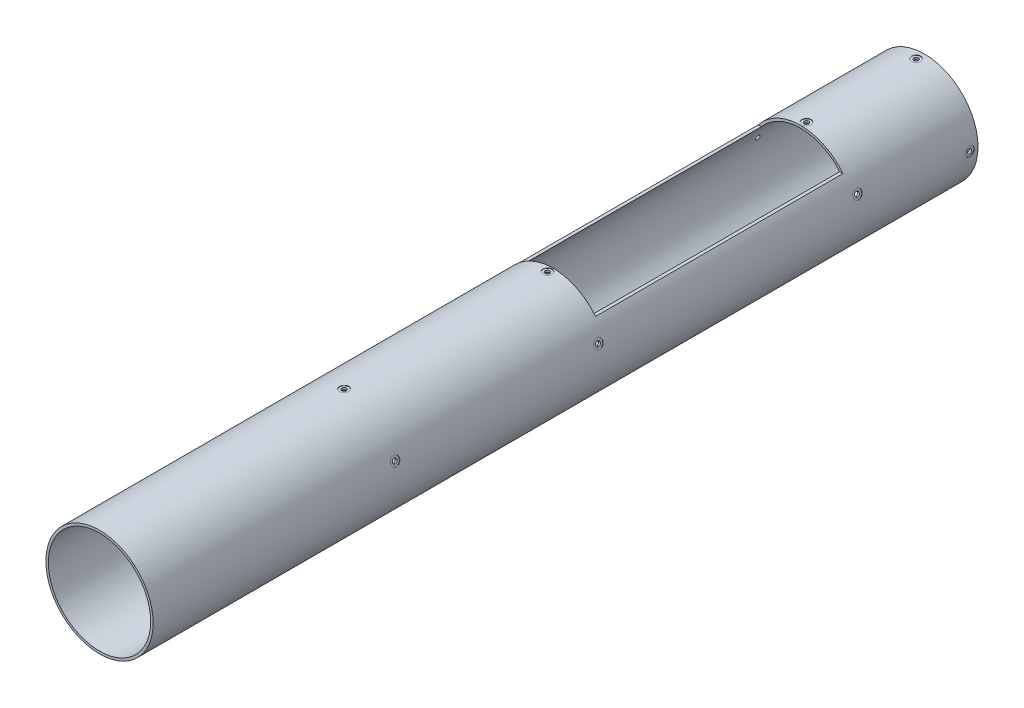
from build123d import *

# Parameters (mm, degrees)
SKETCH1_R                                          = 65
SKETCH1_R_2                                        = 62
BOSS_EXTRUDE1_DEPTH                                = 1000
CUT_EXTRUDE4_REACH                                 = 1009.596
SKETCH4_W                                          = 130
SKETCH4_H                                          = 300
CBORE_FOR_M5_PAN_HEAD_SCREW1_D                     = 5.5
CBORE_FOR_M5_PAN_HEAD_SCREW1_DEPTH                 = 3
CBORE_FOR_M5_PAN_HEAD_SCREW1_CBORE_D               = 11
CBORE_FOR_M5_PAN_HEAD_SCREW1_CBORE_DEPTH           = 0.5
CBORE_FOR_M5_PAN_HEAD_SCREW1_TIP                   = 1.652366702
CBORE_FOR_M5_PAN_HEAD_SCREW1_ON_FACE_2_D           = 5.5
CBORE_FOR_M5_PAN_HEAD_SCREW1_ON_FACE_2_DEPTH       = 3
CBORE_FOR_M5_PAN_HEAD_SCREW1_ON_FACE_2_CBORE_D     = 11
CBORE_FOR_M5_PAN_HEAD_SCREW1_ON_FACE_2_CBORE_DEPTH = 0.5
CBORE_FOR_M5_PAN_HEAD_SCREW1_ON_FACE_2_TIP         = 1.652366702
CBORE_FOR_M5_PAN_HEAD_SCREW1_ON_FACE_3_D           = 5.5
CBORE_FOR_M5_PAN_HEAD_SCREW1_ON_FACE_3_DEPTH       = 3
CBORE_FOR_M5_PAN_HEAD_SCREW1_ON_FACE_3_CBORE_D     = 11
CBORE_FOR_M5_PAN_HEAD_SCREW1_ON_FACE_3_CBORE_DEPTH = 0.5
CBORE_FOR_M5_PAN_HEAD_SCREW1_ON_FACE_3_TIP         = 1.652366702
CBORE_FOR_M5_PAN_HEAD_SCREW1_ON_FACE_4_D           = 5.5
CBORE_FOR_M5_PAN_HEAD_SCREW1_ON_FACE_4_DEPTH       = 3
CBORE_FOR_M5_PAN_HEAD_SCREW1_ON_FACE_4_CBORE_D     = 11
CBORE_FOR_M5_PAN_HEAD_SCREW1_ON_FACE_4_CBORE_DEPTH = 0.5
CBORE_FOR_M5_PAN_HEAD_SCREW1_ON_FACE_4_TIP         = 1.652366702
CBORE_START                                        = 61.938982016
CBORE_FOR_M5_PAN_HEAD_SCREW2_OUTLINE_R             = 2.75
CBORE_FOR_M5_PAN_HEAD_SCREW2_DEPTH                 = 3.061018084
CBORE_START_2                                      = 64.5
CBORE_FOR_M5_PAN_HEAD_SCREW2_2_OUTLINE_R           = 5.5
CBORE_FOR_M5_PAN_HEAD_SCREW2_2_OUTLINE_R_2         = 2.75
CBORE_FOR_M5_PAN_HEAD_SCREW2_2_DEPTH               = 0.5000001
CBORE_START_3                                      = 61.93898197
CBORE_FOR_M5_PAN_HEAD_SCREW2_3_OUTLINE_R           = 2.75
CBORE_FOR_M5_PAN_HEAD_SCREW2_3_DEPTH               = 3.061017746
CBORE_FOR_M5_PAN_HEAD_SCREW2_4_OUTLINE_R           = 5.5
CBORE_FOR_M5_PAN_HEAD_SCREW2_4_OUTLINE_R_2         = 2.75
CBORE_FOR_M5_PAN_HEAD_SCREW2_4_DEPTH               = 0.499999716
CBORE_FOR_M5_PAN_HEAD_SCREW2_5_OUTLINE_R           = 2.75
CBORE_FOR_M5_PAN_HEAD_SCREW2_5_DEPTH               = 3.061017746
CBORE_FOR_M5_PAN_HEAD_SCREW2_6_OUTLINE_R           = 5.5
CBORE_FOR_M5_PAN_HEAD_SCREW2_6_OUTLINE_R_2         = 2.75
CBORE_FOR_M5_PAN_HEAD_SCREW2_6_DEPTH               = 0.499999716
CBORE_START_4                                      = -64.999999716
CBORE_FOR_M5_PAN_HEAD_SCREW2_7_OUTLINE_R           = 2.75
CBORE_FOR_M5_PAN_HEAD_SCREW2_7_DEPTH               = 3.061017746
CBORE_FOR_M5_PAN_HEAD_SCREW2_8_OUTLINE_R           = 5.5
CBORE_FOR_M5_PAN_HEAD_SCREW2_8_OUTLINE_R_2         = 2.75
CBORE_FOR_M5_PAN_HEAD_SCREW2_8_DEPTH               = 0.499999716
CBORE_FOR_M5_PAN_HEAD_SCREW2_9_OUTLINE_R           = 2.75
CBORE_FOR_M5_PAN_HEAD_SCREW2_9_DEPTH               = 3.061017746
CBORE_FOR_M5_PAN_HEAD_SCREW2_10_OUTLINE_R          = 5.5
CBORE_FOR_M5_PAN_HEAD_SCREW2_10_OUTLINE_R_2        = 2.75
CBORE_FOR_M5_PAN_HEAD_SCREW2_10_DEPTH              = 0.499999716
CUT_EXTRUDE8_START                                 = -127
CUT_EXTRUDE8_DEPTH                                 = 112
CBORE_FOR_M5_PAN_HEAD_SCREW3_OUTLINE_R             = 2.75
CBORE_FOR_M5_PAN_HEAD_SCREW3_DEPTH                 = 3.061018084
CBORE_FOR_M5_PAN_HEAD_SCREW3_2_OUTLINE_R           = 5.5
CBORE_FOR_M5_PAN_HEAD_SCREW3_2_OUTLINE_R_2         = 2.75
CBORE_FOR_M5_PAN_HEAD_SCREW3_2_DEPTH               = 0.5000001
CBORE_FOR_M5_PAN_HEAD_SCREW3_3_OUTLINE_R           = 2.75
CBORE_FOR_M5_PAN_HEAD_SCREW3_3_DEPTH               = 3.061017746
CBORE_FOR_M5_PAN_HEAD_SCREW3_4_OUTLINE_R           = 5.5
CBORE_FOR_M5_PAN_HEAD_SCREW3_4_OUTLINE_R_2         = 2.75
CBORE_FOR_M5_PAN_HEAD_SCREW3_4_DEPTH               = 0.499999716
CBORE_FOR_M5_PAN_HEAD_SCREW3_5_OUTLINE_R           = 2.75
CBORE_FOR_M5_PAN_HEAD_SCREW3_5_DEPTH               = 3.061017746
CBORE_FOR_M5_PAN_HEAD_SCREW3_6_OUTLINE_R           = 5.5
CBORE_FOR_M5_PAN_HEAD_SCREW3_6_OUTLINE_R_2         = 2.75
CBORE_FOR_M5_PAN_HEAD_SCREW3_6_DEPTH               = 0.499999716
CBORE_FOR_M5_PAN_HEAD_SCREW3_7_OUTLINE_R           = 2.75
CBORE_FOR_M5_PAN_HEAD_SCREW3_7_DEPTH               = 3.061017746
CBORE_FOR_M5_PAN_HEAD_SCREW3_8_OUTLINE_R           = 5.5
CBORE_FOR_M5_PAN_HEAD_SCREW3_8_OUTLINE_R_2         = 2.75
CBORE_FOR_M5_PAN_HEAD_SCREW3_8_DEPTH               = 0.499999716
CBORE_FOR_M5_PAN_HEAD_SCREW3_9_OUTLINE_R           = 2.75
CBORE_FOR_M5_PAN_HEAD_SCREW3_9_DEPTH               = 3.061017746
CBORE_FOR_M5_PAN_HEAD_SCREW3_10_OUTLINE_R          = 5.5
CBORE_FOR_M5_PAN_HEAD_SCREW3_10_OUTLINE_R_2        = 2.75
CBORE_FOR_M5_PAN_HEAD_SCREW3_10_DEPTH              = 0.499999716


# Read off the part's stored shape, not the designer's step: CBORE for M5 Pan Head Screw2, CBORE for M5 Pan Head Screw3
with BuildPart() as part:
    # Sketch1 → Boss-Extrude1 (new body)
    with BuildSketch(Plane.XY):
        Circle(SKETCH1_R)
        Circle(SKETCH1_R_2, mode=Mode.SUBTRACT)
    extrude(amount=BOSS_EXTRUDE1_DEPTH)

    # Sketch4 → Cut-Extrude4 (cut, up to next)
    with BuildSketch(Plane(origin=(0, 40, 0), x_dir=(1, 0, 0), z_dir=(0, 1, 0)), mode=Mode.PRIVATE) as cut_extrude4_sk1:
        with Locations((0, -300)):
            Rectangle(SKETCH4_W, SKETCH4_H)
    cut_extrude4_tool1 = extrude(cut_extrude4_sk1.sketch, amount=CUT_EXTRUDE4_REACH, mode=Mode.PRIVATE) & part.part
    add(cut_extrude4_tool1.solids().sort_by_distance((0, 40, 300))[0], mode=Mode.SUBTRACT)

    # CBORE for M5 Pan Head Screw1
    with Locations(Plane(origin=(0, 65, 10), x_dir=(1, 0, 0), z_dir=(0, 1, 0))):
        with Locations((0, 0)):
            CounterBoreHole(CBORE_FOR_M5_PAN_HEAD_SCREW1_D / 2, CBORE_FOR_M5_PAN_HEAD_SCREW1_CBORE_D / 2, CBORE_FOR_M5_PAN_HEAD_SCREW1_CBORE_DEPTH, depth=CBORE_FOR_M5_PAN_HEAD_SCREW1_DEPTH)
            with Locations((0, 0, -(CBORE_FOR_M5_PAN_HEAD_SCREW1_DEPTH + CBORE_FOR_M5_PAN_HEAD_SCREW1_TIP / 2))):  # 118° drill point
                Cone(0, CBORE_FOR_M5_PAN_HEAD_SCREW1_D / 2, CBORE_FOR_M5_PAN_HEAD_SCREW1_TIP, mode=Mode.SUBTRACT)

    # CBORE for M5 Pan Head Screw1 on face 2
    with Locations(Plane(origin=(65, 0, 10), x_dir=(0, 0, 1), z_dir=(1, 0, 0))):
        with Locations((0, 0)):
            CounterBoreHole(CBORE_FOR_M5_PAN_HEAD_SCREW1_ON_FACE_2_D / 2, CBORE_FOR_M5_PAN_HEAD_SCREW1_ON_FACE_2_CBORE_D / 2, CBORE_FOR_M5_PAN_HEAD_SCREW1_ON_FACE_2_CBORE_DEPTH, depth=CBORE_FOR_M5_PAN_HEAD_SCREW1_ON_FACE_2_DEPTH)
            with Locations((0, 0, -(CBORE_FOR_M5_PAN_HEAD_SCREW1_ON_FACE_2_DEPTH + CBORE_FOR_M5_PAN_HEAD_SCREW1_ON_FACE_2_TIP / 2))):  # 118° drill point
                Cone(0, CBORE_FOR_M5_PAN_HEAD_SCREW1_ON_FACE_2_D / 2, CBORE_FOR_M5_PAN_HEAD_SCREW1_ON_FACE_2_TIP, mode=Mode.SUBTRACT)

    # CBORE for M5 Pan Head Screw1 on face 3
    with Locations(Plane(origin=(0, -65, 10), x_dir=(0, 0, -1), z_dir=(0, -1, 0))):
        with Locations((0, 0)):
            CounterBoreHole(CBORE_FOR_M5_PAN_HEAD_SCREW1_ON_FACE_3_D / 2, CBORE_FOR_M5_PAN_HEAD_SCREW1_ON_FACE_3_CBORE_D / 2, CBORE_FOR_M5_PAN_HEAD_SCREW1_ON_FACE_3_CBORE_DEPTH, depth=CBORE_FOR_M5_PAN_HEAD_SCREW1_ON_FACE_3_DEPTH)
            with Locations((0, 0, -(CBORE_FOR_M5_PAN_HEAD_SCREW1_ON_FACE_3_DEPTH + CBORE_FOR_M5_PAN_HEAD_SCREW1_ON_FACE_3_TIP / 2))):  # 118° drill point
                Cone(0, CBORE_FOR_M5_PAN_HEAD_SCREW1_ON_FACE_3_D / 2, CBORE_FOR_M5_PAN_HEAD_SCREW1_ON_FACE_3_TIP, mode=Mode.SUBTRACT)

    # CBORE for M5 Pan Head Screw1 on face 4
    with Locations(Plane(origin=(-65, 0, 10), x_dir=(0, 0, -1), z_dir=(-1, 0, 0))):
        with Locations((0, 0)):
            CounterBoreHole(CBORE_FOR_M5_PAN_HEAD_SCREW1_ON_FACE_4_D / 2, CBORE_FOR_M5_PAN_HEAD_SCREW1_ON_FACE_4_CBORE_D / 2, CBORE_FOR_M5_PAN_HEAD_SCREW1_ON_FACE_4_CBORE_DEPTH, depth=CBORE_FOR_M5_PAN_HEAD_SCREW1_ON_FACE_4_DEPTH)
            with Locations((0, 0, -(CBORE_FOR_M5_PAN_HEAD_SCREW1_ON_FACE_4_DEPTH + CBORE_FOR_M5_PAN_HEAD_SCREW1_ON_FACE_4_TIP / 2))):  # 118° drill point
                Cone(0, CBORE_FOR_M5_PAN_HEAD_SCREW1_ON_FACE_4_D / 2, CBORE_FOR_M5_PAN_HEAD_SCREW1_ON_FACE_4_TIP, mode=Mode.SUBTRACT)

    # CBORE for M5 Pan Head Screw2 outline → CBORE for M5 Pan Head Screw2 (cut)
    with BuildSketch(Plane(origin=(0, 0, 0), x_dir=(1, 0, 0), z_dir=(0, 1, 0)).offset(CBORE_START)):
        with Locations((0, -703.5)):
            Circle(CBORE_FOR_M5_PAN_HEAD_SCREW2_OUTLINE_R)
    extrude(amount=CBORE_FOR_M5_PAN_HEAD_SCREW2_DEPTH, mode=Mode.SUBTRACT)

    # CBORE for M5 Pan Head Screw2 2 outline → CBORE for M5 Pan Head Screw2 2 (cut)
    with BuildSketch(Plane(origin=(0, 0, 0), x_dir=(1, 0, 0), z_dir=(0, 1, 0)).offset(CBORE_START_2)):
        with Locations((0, -703.5)):
            Circle(CBORE_FOR_M5_PAN_HEAD_SCREW2_2_OUTLINE_R)
        with Locations((0, -703.5)):
            Circle(CBORE_FOR_M5_PAN_HEAD_SCREW2_2_OUTLINE_R_2, mode=Mode.SUBTRACT)
    extrude(amount=CBORE_FOR_M5_PAN_HEAD_SCREW2_2_DEPTH, mode=Mode.SUBTRACT)

    # CBORE for M5 Pan Head Screw2 3 outline → CBORE for M5 Pan Head Screw2 3 (cut)
    with BuildSketch(Plane(origin=(0, 0, 0), x_dir=(-0.30901699437494795, 0.9510565162951534, 0), z_dir=(0.9510565162951535, 0.3090169943749479, 0)).offset(CBORE_START_3)):
        with Locations((0, 703.5)):
            Circle(CBORE_FOR_M5_PAN_HEAD_SCREW2_3_OUTLINE_R)
    extrude(amount=CBORE_FOR_M5_PAN_HEAD_SCREW2_3_DEPTH, mode=Mode.SUBTRACT)

    # CBORE for M5 Pan Head Screw2 4 outline → CBORE for M5 Pan Head Screw2 4 (cut)
    with BuildSketch(Plane(origin=(0, 0, 0), x_dir=(-0.30901699437494795, 0.9510565162951534, 0), z_dir=(0.9510565162951535, 0.3090169943749479, 0)).offset(CBORE_START_2)):
        with Locations((0, 703.5)):
            Circle(CBORE_FOR_M5_PAN_HEAD_SCREW2_4_OUTLINE_R)
        with Locations((0, 703.5)):
            Circle(CBORE_FOR_M5_PAN_HEAD_SCREW2_4_OUTLINE_R_2, mode=Mode.SUBTRACT)
    extrude(amount=CBORE_FOR_M5_PAN_HEAD_SCREW2_4_DEPTH, mode=Mode.SUBTRACT)

    # CBORE for M5 Pan Head Screw2 5 outline → CBORE for M5 Pan Head Screw2 5 (cut)
    with BuildSketch(Plane(origin=(0, 0, 0), x_dir=(0.8090169943749472, 0.5877852522924732, 0), z_dir=(0.5877852522924732, -0.8090169943749473, 0)).offset(CBORE_START_3)):
        with Locations((0, 703.5)):
            Circle(CBORE_FOR_M5_PAN_HEAD_SCREW2_5_OUTLINE_R)
    extrude(amount=CBORE_FOR_M5_PAN_HEAD_SCREW2_5_DEPTH, mode=Mode.SUBTRACT)

    # CBORE for M5 Pan Head Screw2 6 outline → CBORE for M5 Pan Head Screw2 6 (cut)
    with BuildSketch(Plane(origin=(0, 0, 0), x_dir=(0.8090169943749472, 0.5877852522924732, 0), z_dir=(0.5877852522924732, -0.8090169943749473, 0)).offset(CBORE_START_2)):
        with Locations((0, 703.5)):
            Circle(CBORE_FOR_M5_PAN_HEAD_SCREW2_6_OUTLINE_R)
        with Locations((0, 703.5)):
            Circle(CBORE_FOR_M5_PAN_HEAD_SCREW2_6_OUTLINE_R_2, mode=Mode.SUBTRACT)
    extrude(amount=CBORE_FOR_M5_PAN_HEAD_SCREW2_6_DEPTH, mode=Mode.SUBTRACT)

    # CBORE for M5 Pan Head Screw2 7 outline → CBORE for M5 Pan Head Screw2 7 (cut)
    with BuildSketch(Plane(origin=(0, 0, 0), x_dir=(0.8090169943749478, -0.5877852522924728, 0), z_dir=(0.5877852522924728, 0.8090169943749477, 0)).offset(CBORE_START_4)):
        with Locations((0, -703.5)):
            Circle(CBORE_FOR_M5_PAN_HEAD_SCREW2_7_OUTLINE_R)
    extrude(amount=CBORE_FOR_M5_PAN_HEAD_SCREW2_7_DEPTH, mode=Mode.SUBTRACT)

    # CBORE for M5 Pan Head Screw2 8 outline → CBORE for M5 Pan Head Screw2 8 (cut)
    with BuildSketch(Plane(origin=(0, 0, 0), x_dir=(0.8090169943749478, -0.5877852522924728, 0), z_dir=(0.5877852522924728, 0.8090169943749477, 0)).offset(CBORE_START_4)):
        with Locations((0, -703.5)):
            Circle(CBORE_FOR_M5_PAN_HEAD_SCREW2_8_OUTLINE_R)
        with Locations((0, -703.5)):
            Circle(CBORE_FOR_M5_PAN_HEAD_SCREW2_8_OUTLINE_R_2, mode=Mode.SUBTRACT)
    extrude(amount=CBORE_FOR_M5_PAN_HEAD_SCREW2_8_DEPTH, mode=Mode.SUBTRACT)

    # CBORE for M5 Pan Head Screw2 9 outline → CBORE for M5 Pan Head Screw2 9 (cut)
    with BuildSketch(Plane(origin=(0, 0, 0), x_dir=(0.309016994374947, 0.9510565162951538, 0), z_dir=(0.9510565162951538, -0.30901699437494695, 0)).offset(CBORE_START_4)):
        with Locations((0, 703.5)):
            Circle(CBORE_FOR_M5_PAN_HEAD_SCREW2_9_OUTLINE_R)
    extrude(amount=CBORE_FOR_M5_PAN_HEAD_SCREW2_9_DEPTH, mode=Mode.SUBTRACT)

    # CBORE for M5 Pan Head Screw2 10 outline → CBORE for M5 Pan Head Screw2 10 (cut)
    with BuildSketch(Plane(origin=(0, 0, 0), x_dir=(0.309016994374947, 0.9510565162951538, 0), z_dir=(0.9510565162951538, -0.30901699437494695, 0)).offset(CBORE_START_4)):
        with Locations((0, 703.5)):
            Circle(CBORE_FOR_M5_PAN_HEAD_SCREW2_10_OUTLINE_R)
        with Locations((0, 703.5)):
            Circle(CBORE_FOR_M5_PAN_HEAD_SCREW2_10_OUTLINE_R_2, mode=Mode.SUBTRACT)
    extrude(amount=CBORE_FOR_M5_PAN_HEAD_SCREW2_10_DEPTH, mode=Mode.SUBTRACT)

    # Sketch9 → Cut-Extrude8 (cut)
    with BuildSketch(Plane.XY.offset(150).offset(CUT_EXTRUDE8_START)):
        with BuildLine():
            Line((0, 0), (-37.282468363, -53.244882879))
            ThreePointArc((-37.282468363, -53.244882879), (0, -65), (37.282468363, -53.244882879))
            Line((37.282468363, -53.244882879), (0, 0))
        make_face()
    extrude(amount=CUT_EXTRUDE8_DEPTH, mode=Mode.SUBTRACT)

    # CBORE for M5 Pan Head Screw3 outline → CBORE for M5 Pan Head Screw3 (cut)
    with BuildSketch(Plane(origin=(0, 0, 0), x_dir=(1, 0, 0), z_dir=(0, 1, 0)).offset(CBORE_START)):
        with Locations((0, -457)):
            Circle(CBORE_FOR_M5_PAN_HEAD_SCREW3_OUTLINE_R)
        with Locations((0, -143)):
            Circle(CBORE_FOR_M5_PAN_HEAD_SCREW3_OUTLINE_R)
    extrude(amount=CBORE_FOR_M5_PAN_HEAD_SCREW3_DEPTH, mode=Mode.SUBTRACT)

    # CBORE for M5 Pan Head Screw3 2 outline → CBORE for M5 Pan Head Screw3 2 (cut)
    # profile 1 of 2: a face of its own
    with BuildSketch(Plane(origin=(0, 0, 0), x_dir=(1, 0, 0), z_dir=(0, 1, 0)).offset(CBORE_START_2)):
        with Locations((0, -457)):
            Circle(CBORE_FOR_M5_PAN_HEAD_SCREW3_2_OUTLINE_R)
        with Locations((0, -457)):
            Circle(CBORE_FOR_M5_PAN_HEAD_SCREW3_2_OUTLINE_R_2, mode=Mode.SUBTRACT)
    # profile 2 of 2: a face of its own
    with BuildSketch(Plane(origin=(0, 0, 0), x_dir=(1, 0, 0), z_dir=(0, 1, 0)).offset(CBORE_START_2)):
        with Locations((0, -143)):
            Circle(CBORE_FOR_M5_PAN_HEAD_SCREW3_2_OUTLINE_R)
        with Locations((0, -143)):
            Circle(CBORE_FOR_M5_PAN_HEAD_SCREW3_2_OUTLINE_R_2, mode=Mode.SUBTRACT)
    extrude(amount=CBORE_FOR_M5_PAN_HEAD_SCREW3_2_DEPTH, mode=Mode.SUBTRACT)

    # CBORE for M5 Pan Head Screw3 3 outline → CBORE for M5 Pan Head Screw3 3 (cut)
    with BuildSketch(Plane(origin=(0, 0, 0), x_dir=(-0.30901699437494795, 0.9510565162951534, 0), z_dir=(0.9510565162951535, 0.3090169943749479, 0)).offset(CBORE_START_3)):
        with Locations((0, 457)):
            Circle(CBORE_FOR_M5_PAN_HEAD_SCREW3_3_OUTLINE_R)
        with Locations((0, 143)):
            Circle(CBORE_FOR_M5_PAN_HEAD_SCREW3_3_OUTLINE_R)
    extrude(amount=CBORE_FOR_M5_PAN_HEAD_SCREW3_3_DEPTH, mode=Mode.SUBTRACT)

    # CBORE for M5 Pan Head Screw3 4 outline → CBORE for M5 Pan Head Screw3 4 (cut)
    # profile 1 of 2: a face of its own
    with BuildSketch(Plane(origin=(0, 0, 0), x_dir=(-0.30901699437494795, 0.9510565162951534, 0), z_dir=(0.9510565162951535, 0.3090169943749479, 0)).offset(CBORE_START_2)):
        with Locations((0, 457)):
            Circle(CBORE_FOR_M5_PAN_HEAD_SCREW3_4_OUTLINE_R)
        with Locations((0, 457)):
            Circle(CBORE_FOR_M5_PAN_HEAD_SCREW3_4_OUTLINE_R_2, mode=Mode.SUBTRACT)
    # profile 2 of 2: a face of its own
    with BuildSketch(Plane(origin=(0, 0, 0), x_dir=(-0.30901699437494795, 0.9510565162951534, 0), z_dir=(0.9510565162951535, 0.3090169943749479, 0)).offset(CBORE_START_2)):
        with Locations((0, 143)):
            Circle(CBORE_FOR_M5_PAN_HEAD_SCREW3_4_OUTLINE_R)
        with Locations((0, 143)):
            Circle(CBORE_FOR_M5_PAN_HEAD_SCREW3_4_OUTLINE_R_2, mode=Mode.SUBTRACT)
    extrude(amount=CBORE_FOR_M5_PAN_HEAD_SCREW3_4_DEPTH, mode=Mode.SUBTRACT)

    # CBORE for M5 Pan Head Screw3 5 outline → CBORE for M5 Pan Head Screw3 5 (cut)
    with BuildSketch(Plane(origin=(0, 0, 0), x_dir=(0.8090169943749472, 0.5877852522924732, 0), z_dir=(0.5877852522924732, -0.8090169943749473, 0)).offset(CBORE_START_3)):
        with Locations((0, 457)):
            Circle(CBORE_FOR_M5_PAN_HEAD_SCREW3_5_OUTLINE_R)
        with Locations((0, 143)):
            Circle(CBORE_FOR_M5_PAN_HEAD_SCREW3_5_OUTLINE_R)
    extrude(amount=CBORE_FOR_M5_PAN_HEAD_SCREW3_5_DEPTH, mode=Mode.SUBTRACT)

    # CBORE for M5 Pan Head Screw3 6 outline → CBORE for M5 Pan Head Screw3 6 (cut)
    # profile 1 of 2: a face of its own
    with BuildSketch(Plane(origin=(0, 0, 0), x_dir=(0.8090169943749472, 0.5877852522924732, 0), z_dir=(0.5877852522924732, -0.8090169943749473, 0)).offset(CBORE_START_2)):
        with Locations((0, 457)):
            Circle(CBORE_FOR_M5_PAN_HEAD_SCREW3_6_OUTLINE_R)
        with Locations((0, 457)):
            Circle(CBORE_FOR_M5_PAN_HEAD_SCREW3_6_OUTLINE_R_2, mode=Mode.SUBTRACT)
    # profile 2 of 2: a face of its own
    with BuildSketch(Plane(origin=(0, 0, 0), x_dir=(0.8090169943749472, 0.5877852522924732, 0), z_dir=(0.5877852522924732, -0.8090169943749473, 0)).offset(CBORE_START_2)):
        with Locations((0, 143)):
            Circle(CBORE_FOR_M5_PAN_HEAD_SCREW3_6_OUTLINE_R)
        with Locations((0, 143)):
            Circle(CBORE_FOR_M5_PAN_HEAD_SCREW3_6_OUTLINE_R_2, mode=Mode.SUBTRACT)
    extrude(amount=CBORE_FOR_M5_PAN_HEAD_SCREW3_6_DEPTH, mode=Mode.SUBTRACT)

    # CBORE for M5 Pan Head Screw3 7 outline → CBORE for M5 Pan Head Screw3 7 (cut)
    with BuildSketch(Plane(origin=(0, 0, 0), x_dir=(0.8090169943749478, -0.5877852522924728, 0), z_dir=(0.5877852522924728, 0.8090169943749477, 0)).offset(CBORE_START_4)):
        with Locations((0, -457)):
            Circle(CBORE_FOR_M5_PAN_HEAD_SCREW3_7_OUTLINE_R)
        with Locations((0, -143)):
            Circle(CBORE_FOR_M5_PAN_HEAD_SCREW3_7_OUTLINE_R)
    extrude(amount=CBORE_FOR_M5_PAN_HEAD_SCREW3_7_DEPTH, mode=Mode.SUBTRACT)

    # CBORE for M5 Pan Head Screw3 8 outline → CBORE for M5 Pan Head Screw3 8 (cut)
    # profile 1 of 2: a face of its own
    with BuildSketch(Plane(origin=(0, 0, 0), x_dir=(0.8090169943749478, -0.5877852522924728, 0), z_dir=(0.5877852522924728, 0.8090169943749477, 0)).offset(CBORE_START_4)):
        with Locations((0, -457)):
            Circle(CBORE_FOR_M5_PAN_HEAD_SCREW3_8_OUTLINE_R)
        with Locations((0, -457)):
            Circle(CBORE_FOR_M5_PAN_HEAD_SCREW3_8_OUTLINE_R_2, mode=Mode.SUBTRACT)
    # profile 2 of 2: a face of its own
    with BuildSketch(Plane(origin=(0, 0, 0), x_dir=(0.8090169943749478, -0.5877852522924728, 0), z_dir=(0.5877852522924728, 0.8090169943749477, 0)).offset(CBORE_START_4)):
        with Locations((0, -143)):
            Circle(CBORE_FOR_M5_PAN_HEAD_SCREW3_8_OUTLINE_R)
        with Locations((0, -143)):
            Circle(CBORE_FOR_M5_PAN_HEAD_SCREW3_8_OUTLINE_R_2, mode=Mode.SUBTRACT)
    extrude(amount=CBORE_FOR_M5_PAN_HEAD_SCREW3_8_DEPTH, mode=Mode.SUBTRACT)

    # CBORE for M5 Pan Head Screw3 9 outline → CBORE for M5 Pan Head Screw3 9 (cut)
    with BuildSketch(Plane(origin=(0, 0, 0), x_dir=(0.30901699437494795, 0.9510565162951534, 0), z_dir=(0.9510565162951535, -0.3090169943749479, 0)).offset(CBORE_START_4)):
        with Locations((0, 457)):
            Circle(CBORE_FOR_M5_PAN_HEAD_SCREW3_9_OUTLINE_R)
        with Locations((0, 143)):
            Circle(CBORE_FOR_M5_PAN_HEAD_SCREW3_9_OUTLINE_R)
    extrude(amount=CBORE_FOR_M5_PAN_HEAD_SCREW3_9_DEPTH, mode=Mode.SUBTRACT)

    # CBORE for M5 Pan Head Screw3 10 outline → CBORE for M5 Pan Head Screw3 10 (cut)
    # profile 1 of 2: a face of its own
    with BuildSketch(Plane(origin=(0, 0, 0), x_dir=(0.30901699437494795, 0.9510565162951534, 0), z_dir=(0.9510565162951535, -0.3090169943749479, 0)).offset(CBORE_START_4)):
        with Locations((0, 457)):
            Circle(CBORE_FOR_M5_PAN_HEAD_SCREW3_10_OUTLINE_R)
        with Locations((0, 457)):
            Circle(CBORE_FOR_M5_PAN_HEAD_SCREW3_10_OUTLINE_R_2, mode=Mode.SUBTRACT)
    # profile 2 of 2: a face of its own
    with BuildSketch(Plane(origin=(0, 0, 0), x_dir=(0.30901699437494795, 0.9510565162951534, 0), z_dir=(0.9510565162951535, -0.3090169943749479, 0)).offset(CBORE_START_4)):
        with Locations((0, 143)):
            Circle(CBORE_FOR_M5_PAN_HEAD_SCREW3_10_OUTLINE_R)
        with Locations((0, 143)):
            Circle(CBORE_FOR_M5_PAN_HEAD_SCREW3_10_OUTLINE_R_2, mode=Mode.SUBTRACT)
    extrude(amount=CBORE_FOR_M5_PAN_HEAD_SCREW3_10_DEPTH, mode=Mode.SUBTRACT)


solid = part.part
